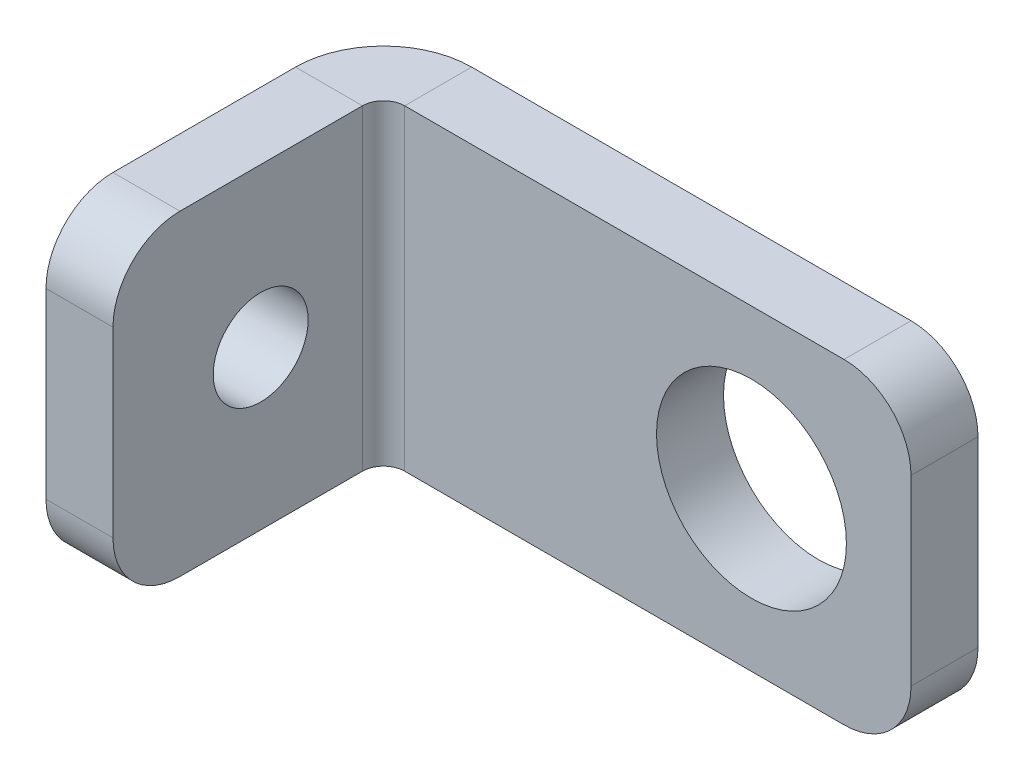
from build123d import *

# Parameters (mm, degrees)
SKETCH1_W                    = 25
SKETCH1_H                    = 15
BASE_FLANGE1_DEPTH           = 3.175
EDGE_FLANGE1_STRIP_W         = 14.7
EDGE_FLANGE1_STRIP_H         = 3.175
EDGE_FLANGE1_STRIP_CUT_DEPTH = 15
EDGE_FLANGE1_DEPTH           = 15
M8_CLEARANCE_HOLE2_D         = 9
FILLET1_R                    = 3.175
M4_CLEARANCE_HOLE2_D         = 4.5


# Sheet-metal steps are written as plain solids
with BuildPart() as part:
    # Sketch1 → Base-Flange1 (new body)
    with BuildSketch(Plane.XY):
        Rectangle(SKETCH1_W, SKETCH1_H)
    extrude(amount=BASE_FLANGE1_DEPTH)

    # Edge-Flange1 strip (across the edge) → Edge-Flange1 strip cut (cut)
    with BuildSketch(Plane(origin=(-12.5, 7.5, 3.175), x_dir=(1, 0, 0), z_dir=(0, -1, 0))):
        with Locations((-6.35, -1.5875)):
            Rectangle(EDGE_FLANGE1_STRIP_W, EDGE_FLANGE1_STRIP_H)
    extrude(amount=EDGE_FLANGE1_STRIP_CUT_DEPTH, mode=Mode.SUBTRACT)

    # Edge-Flange1 section (across the edge) → Edge-Flange1 (add)
    with BuildSketch(Plane(origin=(-12.5, 7.5, 3.175), x_dir=(1, 0, 0), z_dir=(0, -1, 0))):
        with BuildLine():
            Line((-3.175, 1), (-3.175, 12.825))
            Line((-3.175, 12.825), (0, 12.825))
            Line((0, 12.825), (0, 1))
            ThreePointArc((0, 1), (0.292893219, 0.292893219), (1, 0))
            Line((1, 0), (1, -3.175))
            ThreePointArc((1, -3.175), (-1.952170811, -1.952170811), (-3.175, 1))
        make_face()
    extrude(amount=EDGE_FLANGE1_DEPTH)

    # M8 Clearance Hole2 (through all)
    with Locations(Plane.XY.offset(3.175)):
        with Locations((4.9369, 0)):
            Hole(M8_CLEARANCE_HOLE2_D / 2)

    # Fillet1
    fillet1_edges = [part.edges().sort_by_distance(p)[0] for p in [
        (-14.0875, 7.5, 16),
        (-14.0875, -7.5, 16),
        (12.5, -7.5, 1.5875),
        (12.5, 7.5, 1.5875),
    ]]
    fillet(fillet1_edges, radius=FILLET1_R)

    # M4 Clearance Hole2 (through all)
    with Locations(Plane(origin=(-12.5, 0, 0), x_dir=(0, 0, -1), z_dir=(1, 0, 0))):
        with Locations((-9, 0)):
            Hole(M4_CLEARANCE_HOLE2_D / 2)


solid = part.part
